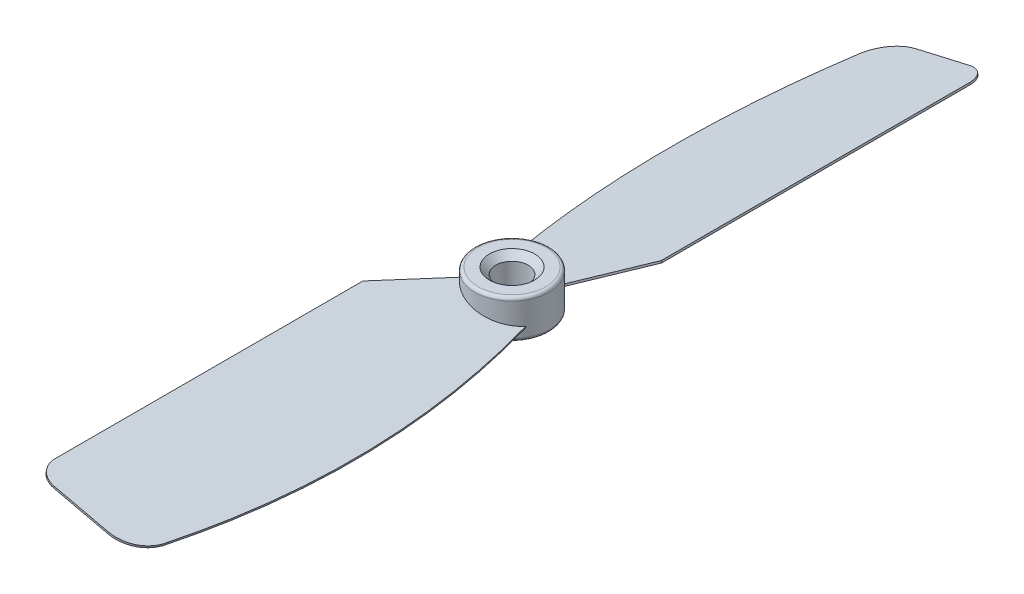
from build123d import *

# Parameters (mm, degrees)
SKETCH1_R           = 5.75
BOSS_EXTRUDE1_DEPTH = 3
BOSS_EXTRUDE3_DEPTH = 0.15
CIRPATTERN1_COUNT   = 2
SKETCH5_R           = 2.5
CUT_EXTRUDE1_DEPTH  = 65.596843827
FILLET1_R           = 0.5
FILLET2_SIZE        = 1


with BuildPart() as part:
    # Sketch1 → Boss-Extrude1 (new, symmetric)
    with BuildSketch(Plane(origin=(0, 0, 0), x_dir=(1, 0, 0), z_dir=(0, 1, 0))):
        Circle(SKETCH1_R)
    extrude(amount=BOSS_EXTRUDE1_DEPTH, both=True)

    # Sketch3 → Boss-Extrude3 (add, symmetric)
    with BuildSketch(Plane(origin=(0, 0, 0), x_dir=(0.9743700647852351, -0.22495105434386542, 0), z_dir=(-0.22495105434386542, -0.9743700647852351, 0))):
        with BuildLine():
            Line((-10.456899563, 12.886138045), (-4.185847137, 2.859510833))
            ThreePointArc((-4.185847137, 2.859510833), (0.450269951, 5.535994412), (5.086387038, 2.859510833))
            add(Edge.make_bspline(
                [(5.086387038, 2.859510833), (5.150424067, 3.115433935), (5.21336865, 3.371423248)],
                knots=[0, 0, 0, 0.009219812, 0.009219812, 0.009219812], degree=2))
            add(Edge.make_bspline(
                [(5.21336865, 3.371423248), (11.977524608, 30.880567729), (6.126015088, 59.154329089)],
                knots=[0.009219812, 0.009219812, 0.009219812, 1, 1, 1], degree=2))
            ThreePointArc((6.126015088, 59.154329089), (4.465099784, 62.259763653), (1.16901464, 63.5))
            Line((1.16901464, 63.5), (-7.456899563, 63.5))
            ThreePointArc((-7.456899563, 63.5), (-9.578219907, 62.621320344), (-10.456899563, 60.5))
            Line((-10.456899563, 60.5), (-10.456899563, 12.886138045))
        make_face()
    boss_extrude3 = extrude(amount=BOSS_EXTRUDE3_DEPTH, both=True)

    # CirPattern1: Boss-Extrude3 ×2 about axis
    cirpattern1_axis = Axis((0, 3, 0), (0, -1, 0))
    for i in range(1, CIRPATTERN1_COUNT):
        add(boss_extrude3.rotate(cirpattern1_axis, i * 360 / CIRPATTERN1_COUNT))

    # Sketch5 → Cut-Extrude1 (cut, through all)
    with BuildSketch(Plane(origin=(0, 3, 0), x_dir=(1, 0, 0), z_dir=(0, 1, 0))):
        Circle(SKETCH5_R)
    extrude(amount=-CUT_EXTRUDE1_DEPTH, mode=Mode.SUBTRACT)

    # Fillet1
    fillet1_edges = [part.edges().sort_by_distance(p)[0] for p in [
        (-5.75, -3, 0),
        (-5.75, 3, 0),
    ]]
    fillet(fillet1_edges, radius=FILLET1_R)

    # Fillet2
    fillet2_edges = [part.edges().sort_by_distance(p)[0] for p in [
        (-2.5, -3, 0),
        (-2.5, 3, 0),
    ]]
    chamfer(fillet2_edges, length=FILLET2_SIZE)


solid = part.part
